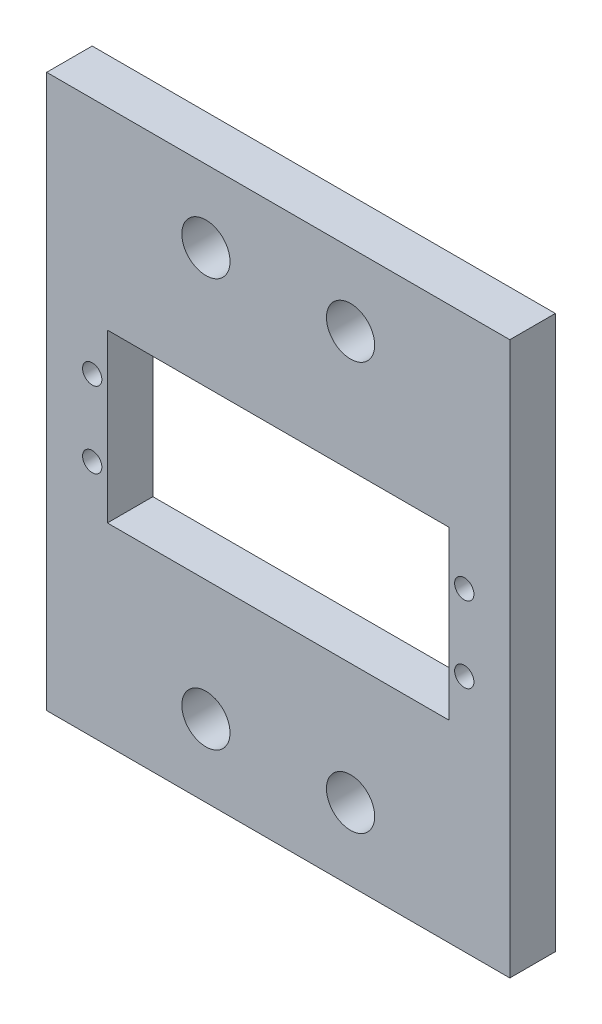
from build123d import *

# Parameters (mm, degrees)
SKETCH1_W           = 61
SKETCH1_H           = 72.8
SKETCH1_R           = 1.27
SKETCH1_R_2         = 3.175
SKETCH1_W_2         = 45
SKETCH1_H_2         = 22
BOSS_EXTRUDE1_DEPTH = 5.9944


with BuildPart() as part:
    # Sketch1 → Boss-Extrude1 (new body)
    with BuildSketch(Plane.XY):
        with Locations((22.5, 11)):
            Rectangle(SKETCH1_W, SKETCH1_H)
        with Locations((-2, 16)):
            Circle(SKETCH1_R, mode=Mode.SUBTRACT)
        with Locations((-2, 6)):
            Circle(SKETCH1_R, mode=Mode.SUBTRACT)
        with Locations((47, 16)):
            Circle(SKETCH1_R, mode=Mode.SUBTRACT)
        with Locations((47, 6)):
            Circle(SKETCH1_R, mode=Mode.SUBTRACT)
        with Locations((12.975, -15.875)):
            Circle(SKETCH1_R_2, mode=Mode.SUBTRACT)
        with Locations((12.975, 37.875)):
            Circle(SKETCH1_R_2, mode=Mode.SUBTRACT)
        with Locations((32.025, 37.875)):
            Circle(SKETCH1_R_2, mode=Mode.SUBTRACT)
        with Locations((32.025, -15.875)):
            Circle(SKETCH1_R_2, mode=Mode.SUBTRACT)
        with Locations((22.5, 11)):
            Rectangle(SKETCH1_W_2, SKETCH1_H_2, mode=Mode.SUBTRACT)
    extrude(amount=BOSS_EXTRUDE1_DEPTH)


solid = part.part
